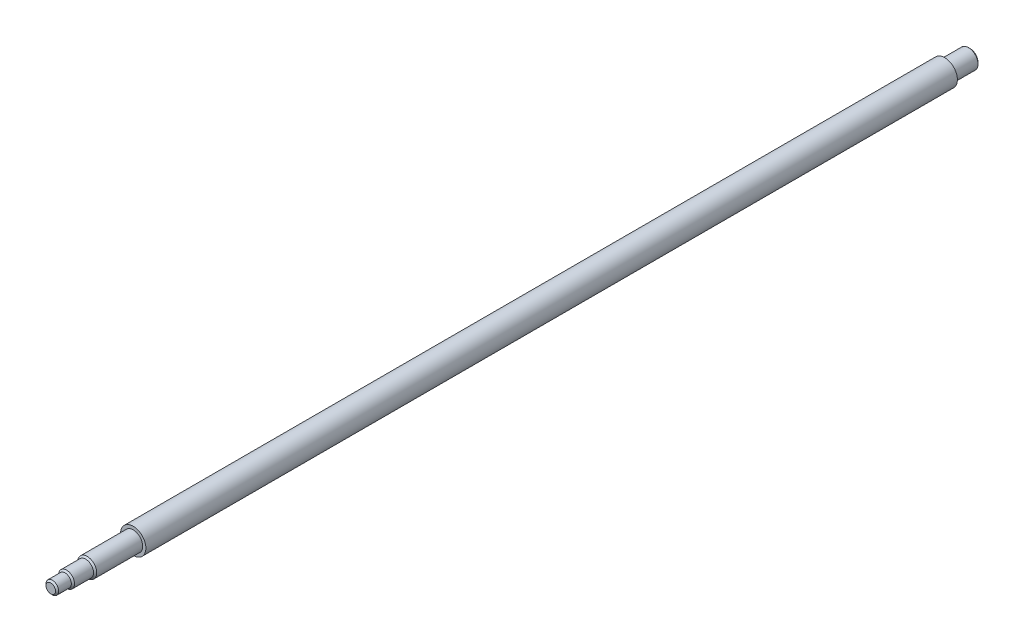
from build123d import *

# Parameters (mm, degrees)
SFAZOWANIE1_SIZE = 1
SFAZOWANIE2_SIZE = 1


with BuildPart() as part:
    # Szkic1 → Obrót1 (revolve)
    with BuildSketch(Plane(origin=(0, 0, 0), x_dir=(0, 0, -1), z_dir=(1, 0, 0)), mode=Mode.PRIVATE) as obr_t1_sk:
        Polygon((0, 0), (580, 0), (580, 6), (564, 6), (564, 8), (52, 8), (52, 6), (22, 6), (22, 5), (9, 5), (9, 4), (0, 4), align=None)
    revolve(obr_t1_sk.sketch.rotate(Axis((0, 0, 0), (0, 0, -1)), 90), axis=Axis((0, 0, 0), (0, 0, -1)))

    # Sfazowanie1
    sfazowanie1_edges = [part.edges().sort_by_distance(p)[0] for p in [
        (-6, 0, -22),
        (-4, 0, 0),
        (-5, 0, -9),
    ]]
    chamfer(sfazowanie1_edges, length=SFAZOWANIE1_SIZE - 0.0001)  # a hair under: the kernel refuses the full size

    # Sfazowanie2
    sfazowanie2_edges = [part.edges().sort_by_distance(p)[0] for p in [
        (-6, 0, -580),
    ]]
    chamfer(sfazowanie2_edges, length=SFAZOWANIE2_SIZE)


solid = part.part
